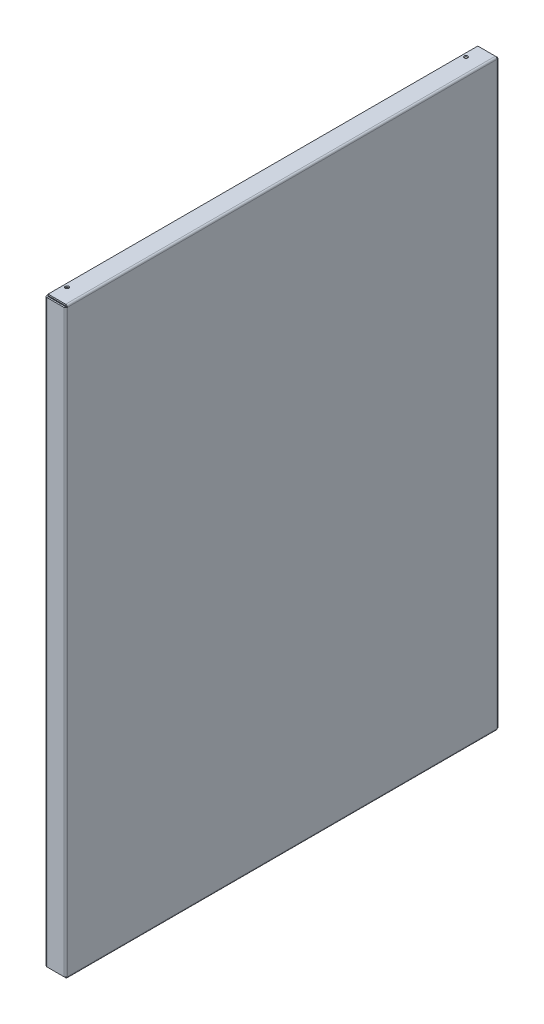
from build123d import *

# Parameters (mm, degrees)
SKETCH2_W                    = 600
SKETCH2_H                    = 812
BASE_FLANGE1_DEPTH           = 2
EDGE_FLANGE1_STRIP_W         = 9
EDGE_FLANGE1_STRIP_H         = 2
EDGE_FLANGE1_STRIP_CUT_DEPTH = 600
EDGE_FLANGE1_DEPTH           = 600
EDGE_FLANGE3_DEPTH           = 809.5
EDGE_FLANGE4_DEPTH           = 809.5
EDGE_FLANGE5_DEPTH           = 600
SKETCH22_R                   = 2.5
CUT_EXTRUDE1_DEPTH           = 870.278724001
SKETCH23_R                   = 2.5
CUT_EXTRUDE2_DEPTH           = 870.278724001
SKETCH24_R                   = 2.5
CUT_EXTRUDE3_DEPTH           = 25
EDGE_FLANGE6_STRIP_W         = 10
EDGE_FLANGE6_STRIP_H         = 2
EDGE_FLANGE6_STRIP_CUT_DEPTH = 809.5
EDGE_FLANGE6_DEPTH           = 809.5
EDGE_FLANGE7_STRIP_W         = 10
EDGE_FLANGE7_STRIP_H         = 2
EDGE_FLANGE7_STRIP_CUT_DEPTH = 809.5
EDGE_FLANGE7_DEPTH           = 809.5
EDGE_FLANGE8_STRIP_W         = 10
EDGE_FLANGE8_STRIP_H         = 2
EDGE_FLANGE8_STRIP_CUT_DEPTH = 809.5
EDGE_FLANGE8_DEPTH           = 809.5
EDGE_FLANGE9_STRIP_W         = 10
EDGE_FLANGE9_STRIP_H         = 2
EDGE_FLANGE9_STRIP_CUT_DEPTH = 809.5
EDGE_FLANGE9_DEPTH           = 809.5


# Sheet-metal steps are written as plain solids
with BuildPart() as part:
    # Sketch2 → Base-Flange1 (new body)
    with BuildSketch(Plane(origin=(0, 0, 0), x_dir=(0, 0, -1), z_dir=(1, 0, 0))):
        Rectangle(SKETCH2_W, SKETCH2_H)
    extrude(amount=-BASE_FLANGE1_DEPTH)

    # Edge-Flange1 strip (across the edge) → Edge-Flange1 strip cut (cut)
    with BuildSketch(Plane(origin=(-2, 406, 300), x_dir=(0, -1, 0), z_dir=(0, 0, -1))):
        with Locations((-2, -1)):
            Rectangle(EDGE_FLANGE1_STRIP_W, EDGE_FLANGE1_STRIP_H)
    extrude(amount=EDGE_FLANGE1_STRIP_CUT_DEPTH, mode=Mode.SUBTRACT)

    # Edge-Flange1 section (across the edge) → Edge-Flange1 (add)
    with BuildSketch(Plane(origin=(-2, 406, 300), x_dir=(0, -1, 0), z_dir=(0, 0, -1))):
        with BuildLine():
            Line((0, 0.5), (0, 25))
            Line((0, 25), (2, 25))
            Line((2, 25), (2, 0.5))
            ThreePointArc((2, 0.5), (2.146446609, 0.146446609), (2.5, 0))
            Line((2.5, 0), (2.5, -2))
            ThreePointArc((2.5, -2), (0.732233047, -1.267766953), (0, 0.5))
        make_face()
    extrude(amount=EDGE_FLANGE1_DEPTH)

    # Edge-Flange3 section (across the edge) → Edge-Flange3 (add)
    with BuildSketch(Plane(origin=(-2, -406, 300.5), x_dir=(0, 0, -1), z_dir=(0, 1, 0))):
        with BuildLine():
            Line((-2, 0.5), (-2, 25))
            Line((-2, 25), (0, 25))
            Line((0, 25), (0, 0.5))
            ThreePointArc((0, 0.5), (0.146446609, 0.146446609), (0.5, 0))
            Line((0.5, 0), (0.5, -2))
            ThreePointArc((0.5, -2), (-1.267766953, -1.267766953), (-2, 0.5))
        make_face()
    extrude(amount=EDGE_FLANGE3_DEPTH)

    # Edge-Flange4 section (across the edge) → Edge-Flange4 (add)
    with BuildSketch(Plane(origin=(-2, 403.5, -300.5), x_dir=(0, 0, 1), z_dir=(0, -1, 0))):
        with BuildLine():
            Line((-2, 0.5), (-2, 25))
            Line((-2, 25), (0, 25))
            Line((0, 25), (0, 0.5))
            ThreePointArc((0, 0.5), (0.146446609, 0.146446609), (0.5, 0))
            Line((0.5, 0), (0.5, -2))
            ThreePointArc((0.5, -2), (-1.267766953, -1.267766953), (-2, 0.5))
        make_face()
    extrude(amount=EDGE_FLANGE4_DEPTH)

    # Edge-Flange5 section (across the edge) → Edge-Flange5 (add)
    with BuildSketch(Plane(origin=(-2, -406.5, -300), x_dir=(0, 1, 0), z_dir=(0, 0, 1))):
        with BuildLine():
            Line((-2, 0.5), (-2, 25))
            Line((-2, 25), (0, 25))
            Line((0, 25), (0, 0.5))
            ThreePointArc((0, 0.5), (0.146446609, 0.146446609), (0.5, 0))
            Line((0.5, 0), (0.5, -2))
            ThreePointArc((0.5, -2), (-1.267766953, -1.267766953), (-2, 0.5))
        make_face()
    extrude(amount=EDGE_FLANGE5_DEPTH)

    # Sketch22 → Cut-Extrude1 (cut, through all)
    with BuildSketch(Plane.XZ.offset(408.5)):
        with Locations((-22, 278.5)):
            Circle(SKETCH22_R)
    extrude(amount=-CUT_EXTRUDE1_DEPTH, mode=Mode.SUBTRACT)

    # Sketch23 → Cut-Extrude2 (cut, through all)
    with BuildSketch(Plane(origin=(0, 406, 0), x_dir=(1, 0, 0), z_dir=(0, 1, 0))):
        with Locations(Location((-22, 278.5, 0), (0, 0, 180))):
            Circle(SKETCH23_R)
    extrude(amount=-CUT_EXTRUDE2_DEPTH, mode=Mode.SUBTRACT)

    # Sketch24 → Cut-Extrude3 (cut)
    with BuildSketch(Plane(origin=(0, 0, -302.5), x_dir=(-1, 0, 0), z_dir=(0, 0, -1))):
        with Locations((22, 382)):
            Circle(SKETCH24_R)
        with Locations((22, -384.5)):
            Circle(SKETCH24_R)
    extrude(amount=-CUT_EXTRUDE3_DEPTH, mode=Mode.SUBTRACT)

    # Edge-Flange6 strip (across the edge) → Edge-Flange6 strip cut (cut)
    with BuildSketch(Plane(origin=(-27, 403.5, -300.5), x_dir=(1, 0, 0), z_dir=(0, -1, 0))):
        with Locations((-4, -1)):
            Rectangle(EDGE_FLANGE6_STRIP_W, EDGE_FLANGE6_STRIP_H)
    extrude(amount=EDGE_FLANGE6_STRIP_CUT_DEPTH, mode=Mode.SUBTRACT)

    # Edge-Flange6 section (across the edge) → Edge-Flange6 (add)
    with BuildSketch(Plane(origin=(-27, 403.5, -300.5), x_dir=(1, 0, 0), z_dir=(0, -1, 0))):
        with BuildLine():
            Line((-2, 1), (-2, 10))
            Line((-2, 10), (0, 10))
            Line((0, 10), (0, 1))
            ThreePointArc((0, 1), (0.292893219, 0.292893219), (1, 0))
            Line((1, 0), (1, -2))
            ThreePointArc((1, -2), (-1.121320344, -1.121320344), (-2, 1))
        make_face()
    extrude(amount=EDGE_FLANGE6_DEPTH)

    # Edge-Flange7 strip (across the edge) → Edge-Flange7 strip cut (cut)
    with BuildSketch(Plane(origin=(-27, 403.5, -290.5), x_dir=(0, 0, -1), z_dir=(0, -1, 0))):
        with Locations((-4, -1)):
            Rectangle(EDGE_FLANGE7_STRIP_W, EDGE_FLANGE7_STRIP_H)
    extrude(amount=EDGE_FLANGE7_STRIP_CUT_DEPTH, mode=Mode.SUBTRACT)

    # Edge-Flange7 section (across the edge) → Edge-Flange7 (add)
    with BuildSketch(Plane(origin=(-27, 403.5, -290.5), x_dir=(0, 0, -1), z_dir=(0, -1, 0))):
        with BuildLine():
            Line((-2, 1), (-2, 20))
            Line((-2, 20), (0, 20))
            Line((0, 20), (0, 1))
            ThreePointArc((0, 1), (0.292893219, 0.292893219), (1, 0))
            Line((1, 0), (1, -2))
            ThreePointArc((1, -2), (-1.121320344, -1.121320344), (-2, 1))
        make_face()
    extrude(amount=EDGE_FLANGE7_DEPTH)

    # Edge-Flange8 strip (across the edge) → Edge-Flange8 strip cut (cut)
    with BuildSketch(Plane(origin=(-27, -406, 300.5), x_dir=(1, 0, 0), z_dir=(0, 1, 0))):
        with Locations((-4, -1)):
            Rectangle(EDGE_FLANGE8_STRIP_W, EDGE_FLANGE8_STRIP_H)
    extrude(amount=EDGE_FLANGE8_STRIP_CUT_DEPTH, mode=Mode.SUBTRACT)

    # Edge-Flange8 section (across the edge) → Edge-Flange8 (add)
    with BuildSketch(Plane(origin=(-27, -406, 300.5), x_dir=(1, 0, 0), z_dir=(0, 1, 0))):
        with BuildLine():
            Line((-2, 1), (-2, 10))
            Line((-2, 10), (0, 10))
            Line((0, 10), (0, 1))
            ThreePointArc((0, 1), (0.292893219, 0.292893219), (1, 0))
            Line((1, 0), (1, -2))
            ThreePointArc((1, -2), (-1.121320344, -1.121320344), (-2, 1))
        make_face()
    extrude(amount=EDGE_FLANGE8_DEPTH)

    # Edge-Flange9 strip (across the edge) → Edge-Flange9 strip cut (cut)
    with BuildSketch(Plane(origin=(-27, -406, 290.5), x_dir=(0, 0, 1), z_dir=(0, 1, 0))):
        with Locations((-4, -1)):
            Rectangle(EDGE_FLANGE9_STRIP_W, EDGE_FLANGE9_STRIP_H)
    extrude(amount=EDGE_FLANGE9_STRIP_CUT_DEPTH, mode=Mode.SUBTRACT)

    # Edge-Flange9 section (across the edge) → Edge-Flange9 (add)
    with BuildSketch(Plane(origin=(-27, -406, 290.5), x_dir=(0, 0, 1), z_dir=(0, 1, 0))):
        with BuildLine():
            Line((-2, 1), (-2, 20))
            Line((-2, 20), (0, 20))
            Line((0, 20), (0, 1))
            ThreePointArc((0, 1), (0.292893219, 0.292893219), (1, 0))
            Line((1, 0), (1, -2))
            ThreePointArc((1, -2), (-1.121320344, -1.121320344), (-2, 1))
        make_face()
    extrude(amount=EDGE_FLANGE9_DEPTH)


solid = part.part
